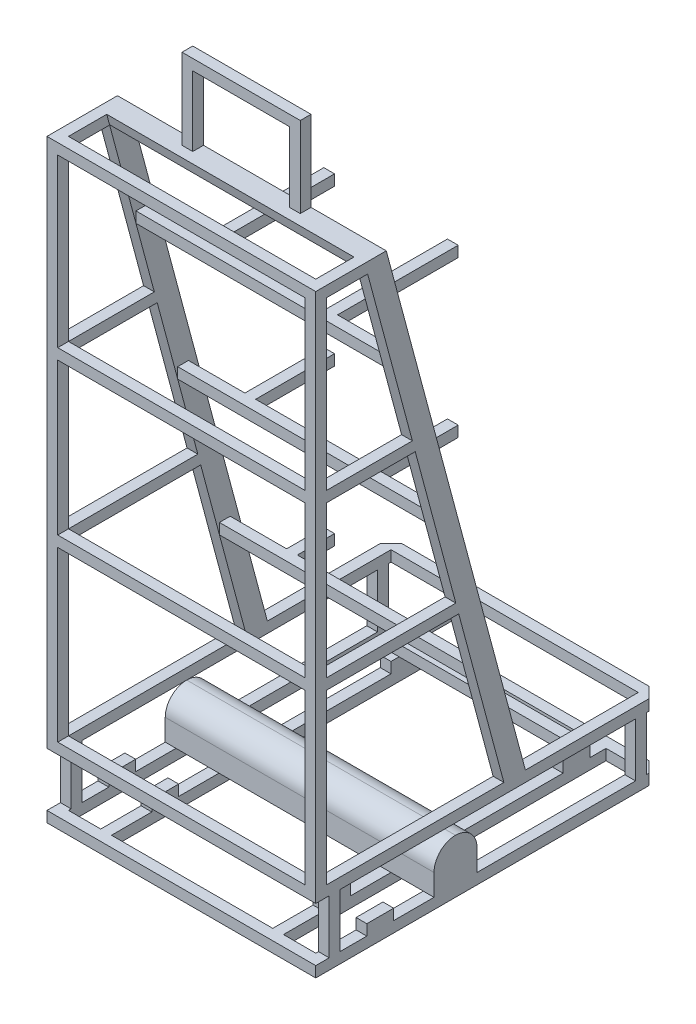
from build123d import *

# Parameters (mm, degrees)
SKETCH1_W            = 500
SKETCH1_H            = 640
BOSS_EXTRUDE1_DEPTH  = 20
SKETCH2_W            = 20
SKETCH2_H            = 20
BOSS_EXTRUDE5_DEPTH  = 100
SKETCH4_W            = 500
SKETCH4_H            = 640
SKETCH4_W_2          = 460
SKETCH4_H_2          = 600
BOSS_EXTRUDE6_DEPTH  = 20
SKETCH5_W            = 20
SKETCH5_H            = 40
BOSS_EXTRUDE10_DEPTH = 1000
BOSS_EXTRUDE11_DEPTH = 460
SKETCH14_W           = 20
SKETCH14_H           = 20
BOSS_EXTRUDE12_DEPTH = 150
SKETCH15_W           = 20
SKETCH15_H           = 20
BOSS_EXTRUDE13_DEPTH = 150
SKETCH16_W           = 20
SKETCH16_H           = 20
BOSS_EXTRUDE14_DEPTH = 180
SKETCH17_W           = 20
SKETCH17_H           = 20
BOSS_EXTRUDE16_DEPTH = 460
SKETCH19_W           = 20
SKETCH19_H           = 20
BOSS_EXTRUDE17_DEPTH = 460
SKETCH20_W           = 20
SKETCH20_H           = 20
BOSS_EXTRUDE18_DEPTH = 460
SKETCH22_W           = 20
SKETCH22_H           = 20
BOSS_EXTRUDE19_DEPTH = 600
SKETCH23_W           = 20
SKETCH23_H           = 50
BOSS_EXTRUDE20_DEPTH = 20
SKETCH24_W           = 20
SKETCH24_H           = 20
BOSS_EXTRUDE21_DEPTH = 20
SKETCH25_W           = 20
SKETCH25_H           = 20
BOSS_EXTRUDE22_DEPTH = 320
SKETCH26_R           = 5
CUT_EXTRUDE1_DEPTH   = 40
SKETCH27_W           = 20
SKETCH27_H           = 50
BOSS_EXTRUDE24_DEPTH = 20
SKETCH28_W           = 20
SKETCH28_H           = 20
BOSS_EXTRUDE25_DEPTH = 965.925826289
BOSS_EXTRUDE26_REACH = 1507.849
SKETCH29_W           = 20
SKETCH29_H           = 20
SKETCH30_W           = 20
SKETCH30_H           = 20
BOSS_EXTRUDE27_DEPTH = 460
CHAMFER1_SIZE        = 20
BOSS_EXTRUDE28_REACH = 1507.849
SKETCH32_W           = 20
SKETCH32_H           = 20
SKETCH33_W           = 20
SKETCH33_H           = 20
BOSS_EXTRUDE29_DEPTH = 460
SKETCH34_W           = 20
SKETCH34_H           = 20
BOSS_EXTRUDE30_DEPTH = 69.175619
SKETCH35_W           = 20
SKETCH35_H           = 20
BOSS_EXTRUDE31_DEPTH = 146.8213321
SKETCH36_W           = 20
SKETCH36_H           = 20
BOSS_EXTRUDE32_DEPTH = 224.467045631
BOSS_EXTRUDE33_DEPTH = 80
FILLET1_R            = 40


with BuildPart() as part:
    # Sketch1 → Boss-Extrude1 (new body)
    with BuildSketch(Plane(origin=(0, 0, 0), x_dir=(1, 0, 0), z_dir=(0, 1, 0))):
        with Locations((303.019035362, -250.937976657)):
            Rectangle(SKETCH1_W, SKETCH1_H)
        Polygon((533.019035362, -250.937976657), (533.019035362, 49.062023343), (73.019035362, 49.062023343), (73.019035362, -550.937976657), (533.019035362, -550.937976657), align=None, mode=Mode.SUBTRACT)
    extrude(amount=BOSS_EXTRUDE1_DEPTH)

    # Sketch2 → Boss-Extrude5 (add)
    with BuildSketch(Plane(origin=(0, 20, 0), x_dir=(1, 0, 0), z_dir=(0, 1, 0))):
        with Locations((543.019035362, -535.937976657)):
            Rectangle(SKETCH2_W, SKETCH2_H)
        with Locations((543.019035362, 34.062023343)):
            Rectangle(SKETCH2_W, SKETCH2_H)
        with Locations((63.019035362, -535.937976657)):
            Rectangle(SKETCH2_W, SKETCH2_H)
        with Locations((63.019035362, 34.062023343)):
            Rectangle(SKETCH2_W, SKETCH2_H)
    extrude(amount=BOSS_EXTRUDE5_DEPTH)

    # Sketch4 → Boss-Extrude6 (add)
    with BuildSketch(Plane(origin=(0, 120, 0), x_dir=(1, 0, 0), z_dir=(0, 1, 0))):
        with Locations((303.019035362, -250.937976657)):
            Rectangle(SKETCH4_W, SKETCH4_H)
        with Locations((303.019035362, -250.937976657)):
            Rectangle(SKETCH4_W_2, SKETCH4_H_2, mode=Mode.SUBTRACT)
    extrude(amount=BOSS_EXTRUDE6_DEPTH)

    # Sketch5 → Boss-Extrude10 (add, along a direction that is not the sketch's normal)
    with BuildSketch(Plane(origin=(0, 140, 0), x_dir=(1, 0, 0), z_dir=(0, 1, 0))):
        with Locations((543.019035362, -200.937976657)):
            Rectangle(SKETCH5_W, SKETCH5_H)
        with Locations((63.019035362, -200.937976657)):
            Rectangle(SKETCH5_W, SKETCH5_H)
    extrude(amount=BOSS_EXTRUDE10_DEPTH, dir=(0, 0.9659258262890672, 0.2588190451025247))

    # Sketch13 → Boss-Extrude11 (add)
    with BuildSketch(Plane(origin=(73.019035362, 0, 0), x_dir=(0, 0, -1), z_dir=(1, 0, 0))):
        Polygon((-479.757021759, 1105.925826289), (-439.757021759, 1105.925826289), (-434.580640857, 1086.607309763), (-474.580640857, 1086.607309763), align=None)
    extrude(amount=BOSS_EXTRUDE11_DEPTH)

    # Sketch14 → Boss-Extrude12 (add)
    with BuildSketch(Plane(origin=(0, 1105.925826289, 0), x_dir=(1, 0, 0), z_dir=(0, 1, 0))):
        with Locations((203.019035362, -449.757021759)):
            Rectangle(SKETCH14_W, SKETCH14_H)
    extrude(amount=BOSS_EXTRUDE12_DEPTH)

    # Sketch15 → Boss-Extrude13 (add)
    with BuildSketch(Plane(origin=(0, 1105.925826289, 0), x_dir=(1, 0, 0), z_dir=(0, 1, 0))):
        with Locations((403.019035362, -449.757021759)):
            Rectangle(SKETCH15_W, SKETCH15_H)
    extrude(amount=BOSS_EXTRUDE13_DEPTH)

    # Sketch16 → Boss-Extrude14 (add)
    with BuildSketch(Plane(origin=(213.019035362, 0, 0), x_dir=(0, 0, -1), z_dir=(1, 0, 0))):
        with Locations((-449.757021759, 1245.925826289)):
            Rectangle(SKETCH16_W, SKETCH16_H)
    extrude(amount=BOSS_EXTRUDE14_DEPTH)

    # Sketch17 → Boss-Extrude16 (add)
    with BuildSketch(Plane.ZY.offset(-533.019035362)):
        with Locations((415.405022288, 913.081402768)):
            Rectangle(SKETCH17_W, SKETCH17_H)
    extrude(amount=BOSS_EXTRUDE16_DEPTH)

    # Sketch19 → Boss-Extrude17 (add)
    with BuildSketch(Plane(origin=(73.019035362, 0, 0), x_dir=(0, 0, -1), z_dir=(1, 0, 0))):
        with Locations((-337.759308757, 623.303654882)):
            Rectangle(SKETCH19_W, SKETCH19_H)
    extrude(amount=BOSS_EXTRUDE17_DEPTH)

    # Sketch20 → Boss-Extrude18 (add)
    with BuildSketch(Plane(origin=(73.019035362, 0, 0), x_dir=(0, 0, -1), z_dir=(1, 0, 0))):
        with Locations((-260.113595226, 333.525906995)):
            Rectangle(SKETCH20_W, SKETCH20_H)
    extrude(amount=BOSS_EXTRUDE18_DEPTH)

    # Sketch22 → Boss-Extrude19 (add)
    with BuildSketch(Plane(origin=(0, 0, 550.937976657), x_dir=(-1, 0, 0), z_dir=(0, 0, -1))):
        with Locations((-143.019035362, 10)):
            Rectangle(SKETCH22_W, SKETCH22_H)
        with Locations((-463.019035362, 10)):
            Rectangle(SKETCH22_W, SKETCH22_H)
    extrude(amount=BOSS_EXTRUDE19_DEPTH)

    # Sketch23 → Boss-Extrude20 (add)
    with BuildSketch(Plane(origin=(0, 20, 0), x_dir=(1, 0, 0), z_dir=(0, 1, 0))):
        with Locations((463.019035362, -5.937976657)):
            Rectangle(SKETCH23_W, SKETCH23_H)
        with Locations((143.019035362, -5.937976657)):
            Rectangle(SKETCH23_W, SKETCH23_H)
    extrude(amount=BOSS_EXTRUDE20_DEPTH)

    # Sketch24 → Boss-Extrude21 (add)
    with BuildSketch(Plane(origin=(0, 40, 0), x_dir=(1, 0, 0), z_dir=(0, 1, 0))):
        with Locations((463.019035362, -5.937976657)):
            Rectangle(SKETCH24_W, SKETCH24_H)
    extrude(amount=BOSS_EXTRUDE21_DEPTH)

    # Sketch25 → Boss-Extrude22 (add)
    with BuildSketch(Plane.ZY.offset(-453.019035362)):
        with Locations((5.937976657, 50)):
            Rectangle(SKETCH25_W, SKETCH25_H)
    extrude(amount=BOSS_EXTRUDE22_DEPTH)

    # Sketch26 → Cut-Extrude1 (cut)
    with BuildSketch(Plane(origin=(0, 60, 0), x_dir=(1, 0, 0), z_dir=(0, 1, 0))):
        with Locations(Location((303.019035362, -5.937976657, 0), (0, 0, 270))):
            Circle(SKETCH26_R)
    extrude(amount=-CUT_EXTRUDE1_DEPTH, mode=Mode.SUBTRACT)

    # Sketch27 → Boss-Extrude24 (add)
    with BuildSketch(Plane(origin=(0, 20, 0), x_dir=(1, 0, 0), z_dir=(0, 1, 0))):
        with Locations((543.019035362, -450.937976657)):
            Rectangle(SKETCH27_W, SKETCH27_H)
        with Locations((463.019035362, -450.937976657)):
            Rectangle(SKETCH27_W, SKETCH27_H)
        with Locations((63.019035362, -450.937976657)):
            Rectangle(SKETCH27_W, SKETCH27_H)
        with Locations((143.019035362, -450.937976657)):
            Rectangle(SKETCH27_W, SKETCH27_H)
    extrude(amount=BOSS_EXTRUDE24_DEPTH)

    # Sketch28 → Boss-Extrude25 (add)
    with BuildSketch(Plane(origin=(0, 140, 0), x_dir=(1, 0, 0), z_dir=(0, 1, 0))):
        with Locations((63.019035362, -560.937976657)):
            Rectangle(SKETCH28_W, SKETCH28_H)
        with Locations((543.019035362, -560.937976657)):
            Rectangle(SKETCH28_W, SKETCH28_H)
    extrude(amount=BOSS_EXTRUDE25_DEPTH)

    # Boss-Extrude26: up to this plane
    boss_extrude26_end = Plane(origin=(553.019035362, 1105.925826289, 479.757021759), z_dir=(0, 0.25881904510252474, -0.9659258262890673))
    # Sketch29 → Boss-Extrude26 (add, up to the surface)
    with BuildSketch(Plane(origin=(0, 0, 550.937976657), x_dir=(-1, 0, 0), z_dir=(0, 0, -1)), mode=Mode.PRIVATE) as boss_extrude26_sk1:
        with Locations((-63.019035362, 1095.925826289)):
            Rectangle(SKETCH29_W, SKETCH29_H)
    boss_extrude26_tool1 = split(extrude(boss_extrude26_sk1.sketch, amount=BOSS_EXTRUDE26_REACH, mode=Mode.PRIVATE), bisect_by=boss_extrude26_end, keep=Keep.BOTH, mode=Mode.PRIVATE)
    add(boss_extrude26_tool1.solids().sort_by_distance((63.019035, 1095.925826, 550.937977))[0])
    # Sketch29 → Boss-Extrude26 (add, up to the surface)
    with BuildSketch(Plane(origin=(0, 0, 550.937976657), x_dir=(-1, 0, 0), z_dir=(0, 0, -1)), mode=Mode.PRIVATE) as boss_extrude26_sk2:
        with Locations((-543.019035362, 1095.925826289)):
            Rectangle(SKETCH29_W, SKETCH29_H)
    boss_extrude26_tool2 = split(extrude(boss_extrude26_sk2.sketch, amount=BOSS_EXTRUDE26_REACH, mode=Mode.PRIVATE), bisect_by=boss_extrude26_end, keep=Keep.BOTH, mode=Mode.PRIVATE)
    add(boss_extrude26_tool2.solids().sort_by_distance((543.019035, 1095.925826, 550.937977))[0])

    # Sketch30 → Boss-Extrude27 (add)
    with BuildSketch(Plane(origin=(73.019035362, 0, 0), x_dir=(0, 0, -1), z_dir=(1, 0, 0))):
        with Locations((-560.937976657, 1095.925826289)):
            Rectangle(SKETCH30_W, SKETCH30_H)
    extrude(amount=BOSS_EXTRUDE27_DEPTH)

    # Chamfer1
    chamfer1_edges = [part.edges().sort_by_distance(p)[0] for p in [
        (53.019035362, 10, -69.062023343),
        (553.019035362, 10, -69.062023343),
        (53.019035362, 130, -69.062023343),
        (553.019035362, 130, -69.062023343),
    ]]
    chamfer(chamfer1_edges, length=CHAMFER1_SIZE)

    # Boss-Extrude28: up to this plane
    boss_extrude28_end = Plane(origin=(553.019035362, 1105.925826289, 479.757021759), z_dir=(0, 0.25881904510252474, -0.9659258262890673))
    # Sketch32 → Boss-Extrude28 (add, up to the surface)
    with BuildSketch(Plane(origin=(0, 0, 550.937976657), x_dir=(-1, 0, 0), z_dir=(0, 0, -1)), mode=Mode.PRIVATE) as boss_extrude28_sk1:
        with Locations((-63.019035362, 765.515215465)):
            Rectangle(SKETCH32_W, SKETCH32_H)
    boss_extrude28_tool1 = split(extrude(boss_extrude28_sk1.sketch, amount=BOSS_EXTRUDE28_REACH, mode=Mode.PRIVATE), bisect_by=boss_extrude28_end, keep=Keep.BOTH, mode=Mode.PRIVATE)
    add(boss_extrude28_tool1.solids().sort_by_distance((63.019035, 765.515215, 550.937977))[0])
    # Sketch32 → Boss-Extrude28 (add, up to the surface)
    with BuildSketch(Plane(origin=(0, 0, 550.937976657), x_dir=(-1, 0, 0), z_dir=(0, 0, -1)), mode=Mode.PRIVATE) as boss_extrude28_sk2:
        with Locations((-63.019035362, 463.654344784)):
            Rectangle(SKETCH32_W, SKETCH32_H)
    boss_extrude28_tool2 = split(extrude(boss_extrude28_sk2.sketch, amount=BOSS_EXTRUDE28_REACH, mode=Mode.PRIVATE), bisect_by=boss_extrude28_end, keep=Keep.BOTH, mode=Mode.PRIVATE)
    add(boss_extrude28_tool2.solids().sort_by_distance((63.019035, 463.654345, 550.937977))[0])
    # Sketch32 → Boss-Extrude28 (add, up to the surface)
    with BuildSketch(Plane(origin=(0, 0, 550.937976657), x_dir=(-1, 0, 0), z_dir=(0, 0, -1)), mode=Mode.PRIVATE) as boss_extrude28_sk3:
        with Locations((-543.019035362, 463.654344784)):
            Rectangle(SKETCH32_W, SKETCH32_H)
    boss_extrude28_tool3 = split(extrude(boss_extrude28_sk3.sketch, amount=BOSS_EXTRUDE28_REACH, mode=Mode.PRIVATE), bisect_by=boss_extrude28_end, keep=Keep.BOTH, mode=Mode.PRIVATE)
    add(boss_extrude28_tool3.solids().sort_by_distance((543.019035, 463.654345, 550.937977))[0])
    # Sketch32 → Boss-Extrude28 (add, up to the surface)
    with BuildSketch(Plane(origin=(0, 0, 550.937976657), x_dir=(-1, 0, 0), z_dir=(0, 0, -1)), mode=Mode.PRIVATE) as boss_extrude28_sk4:
        with Locations((-543.019035362, 765.515215465)):
            Rectangle(SKETCH32_W, SKETCH32_H)
    boss_extrude28_tool4 = split(extrude(boss_extrude28_sk4.sketch, amount=BOSS_EXTRUDE28_REACH, mode=Mode.PRIVATE), bisect_by=boss_extrude28_end, keep=Keep.BOTH, mode=Mode.PRIVATE)
    add(boss_extrude28_tool4.solids().sort_by_distance((543.019035, 765.515215, 550.937977))[0])

    # Sketch33 → Boss-Extrude29 (add)
    with BuildSketch(Plane(origin=(73.019035362, 0, 0), x_dir=(0, 0, -1), z_dir=(1, 0, 0))):
        with Locations((-560.937976657, 765.515215465)):
            Rectangle(SKETCH33_W, SKETCH33_H)
        with Locations((-560.937976657, 463.654344784)):
            Rectangle(SKETCH33_W, SKETCH33_H)
    extrude(amount=BOSS_EXTRUDE29_DEPTH)

    # Sketch34 → Boss-Extrude30 (add)
    with BuildSketch(Plane(origin=(0, 0, 250.113595226), x_dir=(-1, 0, 0), z_dir=(0, 0, -1))):
        with Locations((-188.019035362, 333.525906995)):
            Rectangle(SKETCH34_W, SKETCH34_H)
        with Locations((-418.019035362, 333.525906995)):
            Rectangle(SKETCH34_W, SKETCH34_H)
    extrude(amount=BOSS_EXTRUDE30_DEPTH)

    # Sketch35 → Boss-Extrude31 (add)
    with BuildSketch(Plane(origin=(0, 0, 327.759308757), x_dir=(-1, 0, 0), z_dir=(0, 0, -1))):
        with Locations((-418.019035362, 623.303654882)):
            Rectangle(SKETCH35_W, SKETCH35_H)
        with Locations((-188.019035362, 623.303654882)):
            Rectangle(SKETCH35_W, SKETCH35_H)
    extrude(amount=BOSS_EXTRUDE31_DEPTH)

    # Sketch36 → Boss-Extrude32 (add)
    with BuildSketch(Plane(origin=(0, 0, 405.405022288), x_dir=(-1, 0, 0), z_dir=(0, 0, -1))):
        with Locations((-188.019035362, 913.081402768)):
            Rectangle(SKETCH36_W, SKETCH36_H)
        with Locations((-418.019035362, 913.081402768)):
            Rectangle(SKETCH36_W, SKETCH36_H)
    extrude(amount=BOSS_EXTRUDE32_DEPTH)

    # Sketch37 → Boss-Extrude33 (add)
    with BuildSketch(Plane(origin=(0, 20, 0), x_dir=(1, 0, 0), z_dir=(0, 1, 0))):
        Polygon((53.019035362, -310.937976657), (53.019035362, -350.937976657), (553.019035362, -350.937976657), (553.019035362, -270.937976657), (53.019035362, -270.937976657), align=None)
    extrude(amount=BOSS_EXTRUDE33_DEPTH)

    # Fillet1
    fillet1_edges = [part.edges().sort_by_distance(p)[0] for p in [
        (303.019035362, 100, 350.937976657),
        (303.019035362, 100, 270.937976657),
    ]]
    fillet(fillet1_edges, radius=FILLET1_R - 0.0001)  # a hair under: the kernel refuses the full size


solid = part.part
